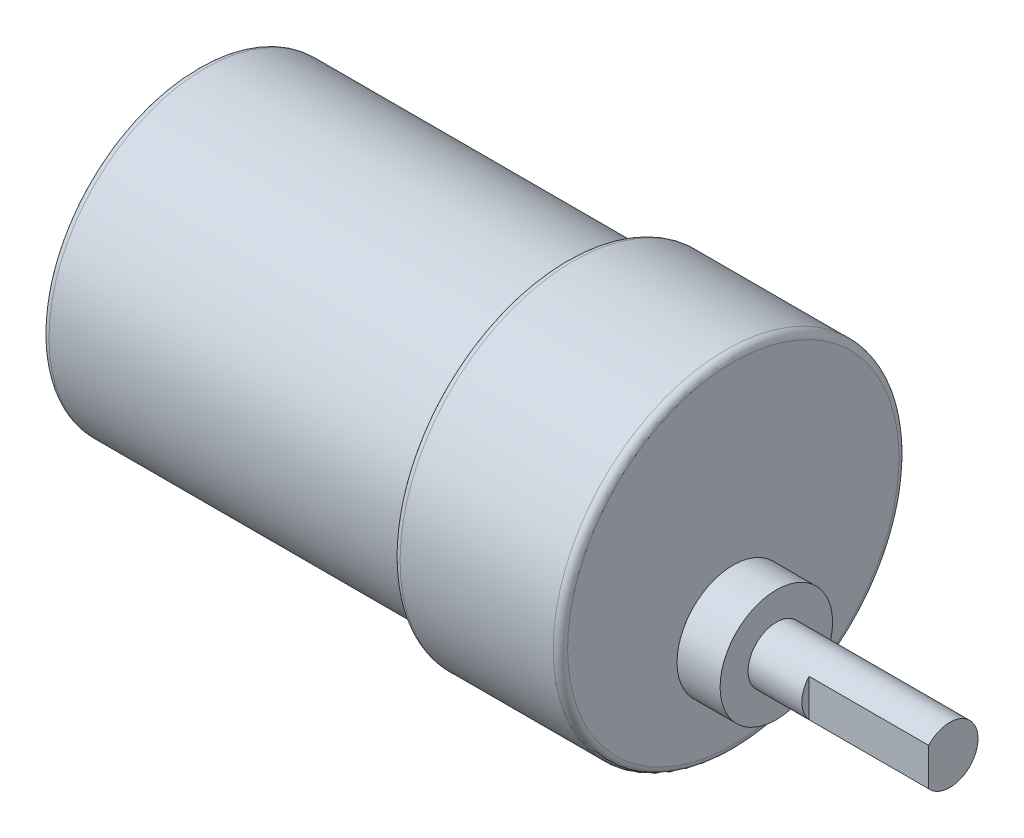
from build123d import *

# Parameters (mm, degrees)
SKETCH2_R           = 5.969
BOSS_EXTRUDE1_DEPTH = 4.572
SKETCH3_R           = 3
BOSS_EXTRUDE2_DEPTH = 18.415
FILLET1_R           = 0.762
SKETCH4_W           = 12.7
SKETCH4_H           = 0.762
CUT_EXTRUDE1_DEPTH  = 84.993147323


with BuildPart() as part:
    # Sketch1 → Revolve1 (revolve)
    with BuildSketch(Plane.XY):
        Polygon((0, 3.175), (0, 16.51), (39.116, 16.51), (39.116, 18.3515), (56.896, 18.3515), (56.896, 0), (-2.286, 0), (-2.286, 3.175), align=None)
    revolve(axis=Axis((-2.286, 0, 0), (1, 0, 0)))

    # Sketch2 → Boss-Extrude1 (add)
    with BuildSketch(Plane(origin=(56.896, 0, 0), x_dir=(0, 0, -1), z_dir=(1, 0, 0))):
        with Locations((0, -7.0358)):
            Circle(SKETCH2_R)
    extrude(amount=BOSS_EXTRUDE1_DEPTH)

    # Sketch3 → Boss-Extrude2 (add)
    with BuildSketch(Plane(origin=(61.468, 0, 0), x_dir=(0, 0, -1), z_dir=(1, 0, 0))):
        with Locations((0, -7.0358)):
            Circle(SKETCH3_R)
    extrude(amount=BOSS_EXTRUDE2_DEPTH)

    # Fillet1
    fillet1_edges = [part.edges().sort_by_distance(p)[0] for p in [
        (56.896, -18.3515, 0),
        (39.116, -18.3515, 0),
        (0, -16.51, 0),
        (-2.286, -3.175, 0),
    ]]
    fillet(fillet1_edges, radius=FILLET1_R)

    # Sketch4 → Cut-Extrude1 (cut, through all)
    with BuildSketch(Plane(origin=(0, 0, 0), x_dir=(1, 0, 0), z_dir=(0, 1, 0))):
        with Locations((73.533, -2.619)):
            Rectangle(SKETCH4_W, SKETCH4_H)
    extrude(amount=-CUT_EXTRUDE1_DEPTH, mode=Mode.SUBTRACT)


solid = part.part
